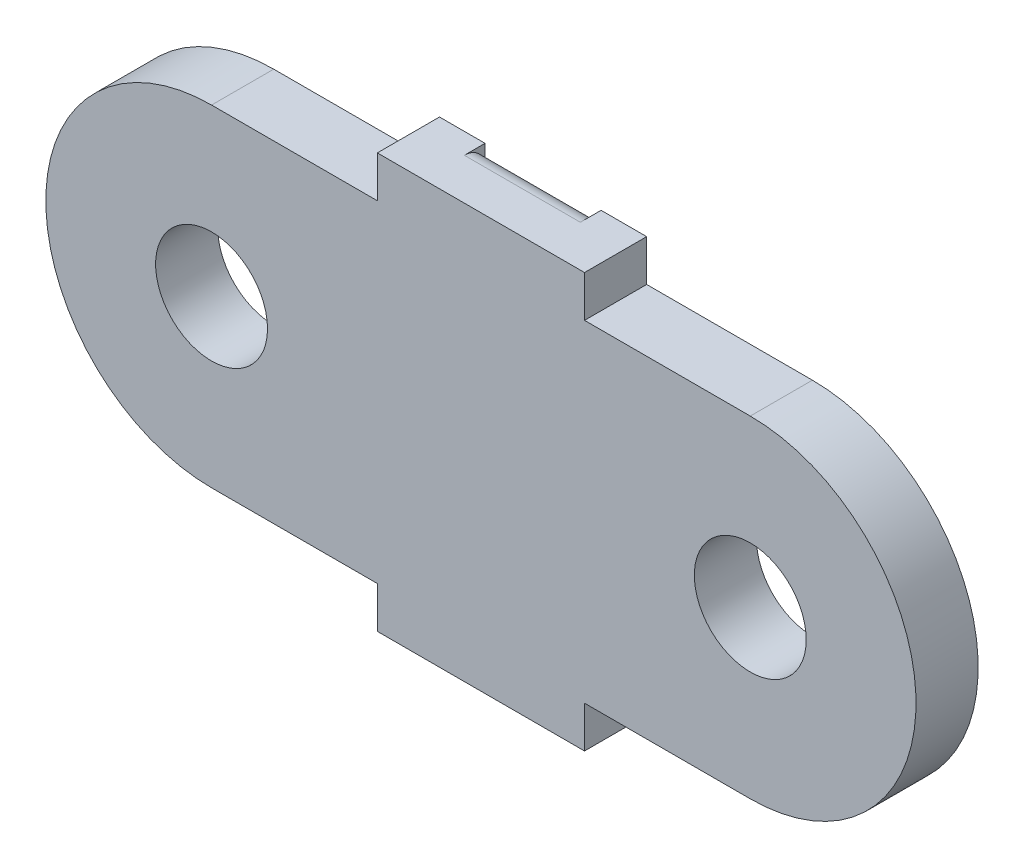
from build123d import *

# Parameters (mm, degrees)
SKETCH_1_W           = 8
SKETCH_1_H           = 8
SKETCH_1_W_2         = 5
SKETCH_1_H_2         = 10
EXTRUDE_709_DEPTH    = 1.5
HOLE_WIZARD_M2_5_1_D = 2.7
FILLET_1_RADIUS      = 4
FILLET_1_LENGTH      = 1.5
FILLET_2_RADIUS      = 4
FILLET_2_LENGTH      = 1.5
FILLET_START         = -1.4
FILLET_3_DEPTH       = 2.8


with BuildPart() as part:
    # 草图1 → Extrude 709 (new body)
    with BuildSketch(Plane.XY):
        with Locations((6.5, 0)):
            Rectangle(SKETCH_1_W, SKETCH_1_H)
        Rectangle(SKETCH_1_W_2, SKETCH_1_H_2)
        with Locations((-6.5, 0)):
            Rectangle(SKETCH_1_W, SKETCH_1_H)
    extrude(amount=EXTRUDE_709_DEPTH)

    # M2.5 间隙孔1 (through all)
    with Locations(Plane.XY.offset(1.5)):
        with Locations((6.5, 0)):
            hole_wizard_m2_5_1 = Hole(HOLE_WIZARD_M2_5_1_D / 2)

    # 镜向2: M2.5 间隙孔1 across plane
    add(hole_wizard_m2_5_1.mirror(Plane(origin=(0, 0, 0), x_dir=(0, 0, 1), z_dir=(1, 0, 0))), mode=Mode.SUBTRACT)

    # 圆角1: full round fillet: the end face becomes a half cylinder, R = half its width
    fillet_1_face = Plane((10.5, 0, 0.75), x_dir=(0, 0, -1), z_dir=(1, 0, 0))  # on the end face: x along it, z out of the body
    fillet_1_slab = fillet_1_face.offset(-FILLET_1_RADIUS / 2) * Box(FILLET_1_LENGTH, 2 * FILLET_1_RADIUS, FILLET_1_RADIUS, mode=Mode.PRIVATE)  # the body's end, R deep
    fillet_1_round = Plane((6.5, 0, 0.75), x_dir=(1, 0, 0), z_dir=(0, 0, -1)) * Cylinder(FILLET_1_RADIUS, FILLET_1_LENGTH, mode=Mode.PRIVATE)  # its axis R under the face
    add(fillet_1_slab - fillet_1_round, mode=Mode.SUBTRACT)

    # 圆角2: full round fillet: the end face becomes a half cylinder, R = half its width
    fillet_2_face = Plane((-10.5, 0, 0.75), x_dir=(0, 0, 1), z_dir=(-1, 0, 0))  # on the end face: x along it, z out of the body
    fillet_2_slab = fillet_2_face.offset(-FILLET_2_RADIUS / 2) * Box(FILLET_2_LENGTH, 2 * FILLET_2_RADIUS, FILLET_2_RADIUS, mode=Mode.PRIVATE)  # the body's end, R deep
    fillet_2_round = Plane((-6.5, 0, 0.75), x_dir=(-1, 0, 0), z_dir=(0, 0, 1)) * Cylinder(FILLET_2_RADIUS, FILLET_2_LENGTH, mode=Mode.PRIVATE)  # its axis R under the face
    add(fillet_2_slab - fillet_2_round, mode=Mode.SUBTRACT)

    # 圆角3: read off the stored shape, not the designer's step
    # 圆角3 outline → 圆角3 (cut)
    with BuildSketch(Plane.YZ.offset(FILLET_START)):
        with BuildLine():
            Line((5, 0), (5, 0.5))
            ThreePointArc((5, 0.5), (4.853553391, 0.146446609), (4.5, 0))
            Line((4.5, 0), (5, 0))
        make_face()
        with BuildLine():
            Line((-5, 0), (-4.5, 0))
            ThreePointArc((-4.5, 0), (-4.853553391, 0.146446609), (-5, 0.5))
            Line((-5, 0.5), (-5, 0))
        make_face()
    extrude(amount=FILLET_3_DEPTH, mode=Mode.SUBTRACT)


solid = part.part
